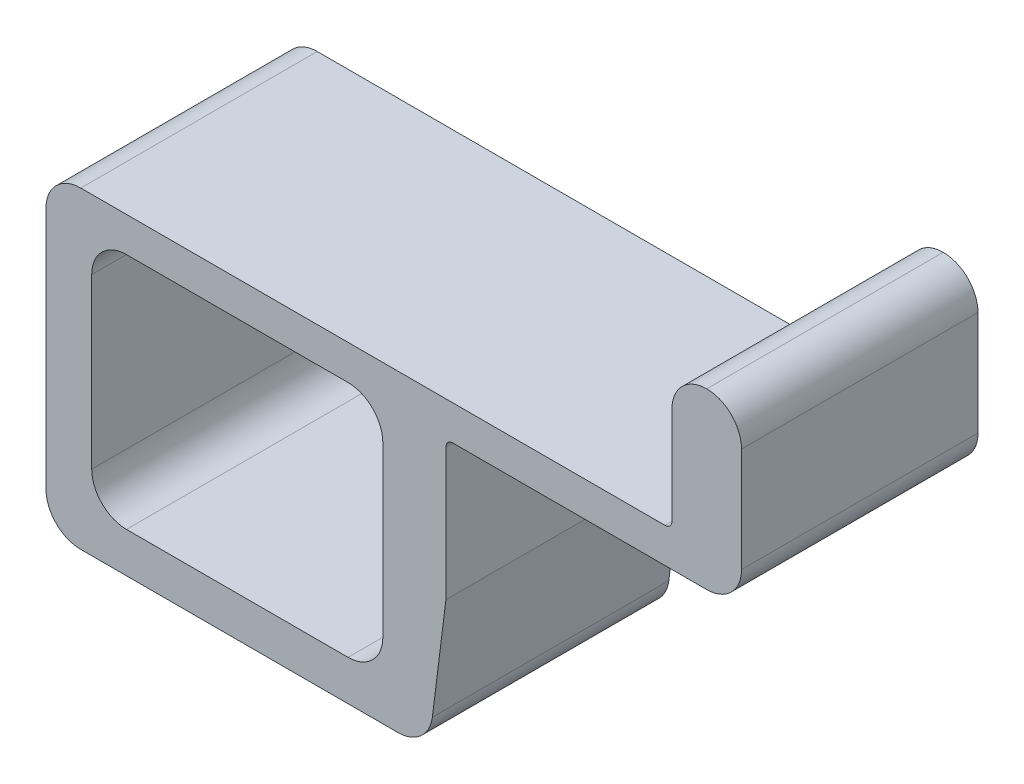
from build123d import *

# Parameters (mm, degrees)
SKETCH1_W           = 41.858784395
SKETCH1_H           = 34.22014658
BOSS_EXTRUDE1_DEPTH = 34
FILLET1_R           = 1
FILLET2_R           = 5
FILLET3_R           = 5


with BuildPart() as part:
    # Sketch1 → Boss-Extrude1 (new body)
    with BuildSketch(Plane.XY):
        Polygon((23.981900452, 10.610859729), (-16.018099548, 10.610859729), (-18.518099548, 10.610859729), (-18.518099548, -9.389140271), (-21.018099548, -29.389140271), (-76.018099548, -29.389140271), (-76.018099548, 10.610859729), (-76.018099548, 15.610859729), (13.981900452, 15.610859729), (13.981900452, 35.610859729), (23.981900452, 35.610859729), (23.981900452, 15.610859729), align=None)
        with Locations((-48.518099548, -6.499213561)):
            Rectangle(SKETCH1_W, SKETCH1_H, mode=Mode.SUBTRACT)
    extrude(amount=BOSS_EXTRUDE1_DEPTH)

    # Fillet1
    fillet1_edges = [part.edges().sort_by_distance(p)[0] for p in [
        (-18.518099548, 10.610859729, 17),
        (13.981900452, 15.610859729, 17),
    ]]
    fillet(fillet1_edges, radius=FILLET1_R)

    # Fillet2
    fillet2_edges = [part.edges().sort_by_distance(p)[0] for p in [
        (-27.58870735, 10.610859729, 17),
        (-69.447491745, 10.610859729, 17),
        (-69.447491745, -23.609286851, 17),
        (-27.58870735, -23.609286851, 17),
    ]]
    fillet(fillet2_edges, radius=FILLET2_R)

    # Fillet3
    fillet3_edges = [part.edges().sort_by_distance(p)[0] for p in [
        (13.981900452, 35.610859729, 17),
        (23.981900452, 35.610859729, 17),
        (23.981900452, 10.610859729, 17),
        (-76.018099548, 15.610859729, 17),
        (-76.018099548, -29.389140271, 17),
        (-21.018099548, -29.389140271, 17),
    ]]
    fillet(fillet3_edges, radius=FILLET3_R - 0.0001)  # a hair under: the kernel refuses the full size


solid = part.part
